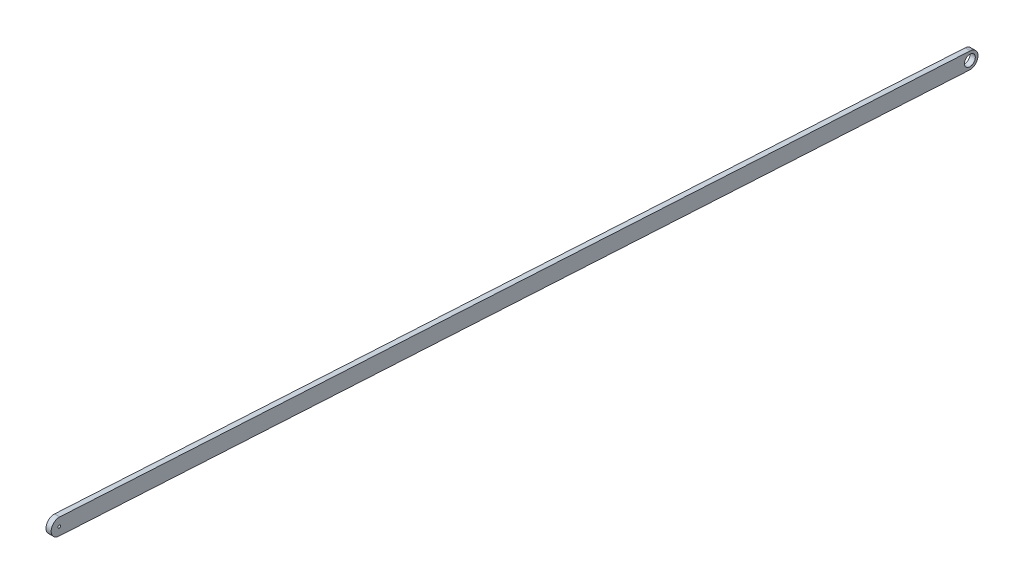
from build123d import *

# Parameters (mm, degrees)
SKETCH1_R           = 3.175
SKETCH1_R_2         = 0.79375
BOSS_EXTRUDE1_DEPTH = 3.03784


with BuildPart() as part:
    # Sketch1 → Boss-Extrude1 (new body)
    with BuildSketch(Plane(origin=(0, 0, 0), x_dir=(0, 0, -1), z_dir=(1, 0, 0))):
        with BuildLine():
            Line((-199.935846234, 20.090149666), (332.451842929, -10.103903915))
            ThreePointArc((332.451842929, -10.103903915), (337.476371035, -5.618713862), (332.991180981, -0.594185756))
            Line((332.991180981, -0.594185756), (-199.396508181, 29.599867825))
            ThreePointArc((-199.396508181, 29.599867825), (-204.421036287, 25.114677772), (-199.935846234, 20.090149666))
        make_face()
        with Locations((332.721511955, -5.349044835)):
            Circle(SKETCH1_R, mode=Mode.SUBTRACT)
        with Locations((-199.666177208, 24.845008746)):
            Circle(SKETCH1_R_2, mode=Mode.SUBTRACT)
    extrude(amount=BOSS_EXTRUDE1_DEPTH)


solid = part.part
